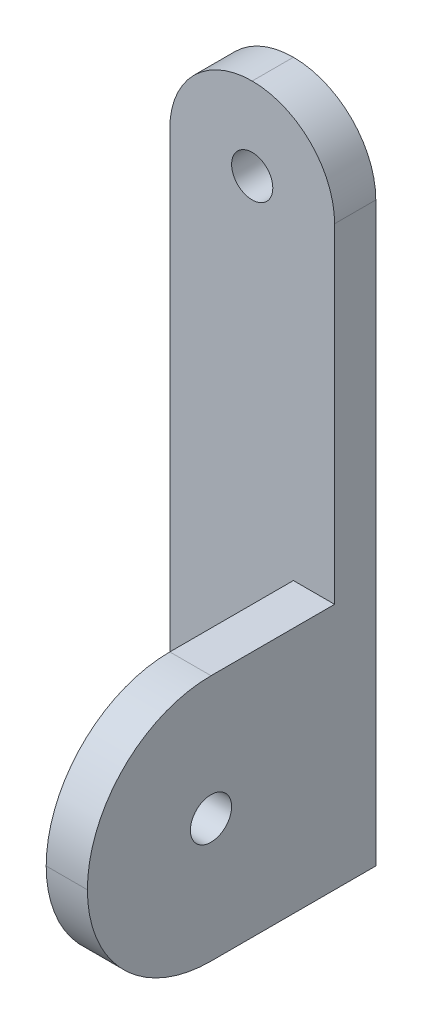
from build123d import *

# Parameters (mm, degrees)
ESQUISSE1_W             = 20
ESQUISSE1_H             = 80
BOSS_EXTRU_1_DEPTH      = 5
ESQUISSE2_R             = 2.5
ENL_V_MAT_EXTRU_1_DEPTH = 5
ESQUISSE3_W             = 5
ESQUISSE3_H             = 30
BOSS_EXTRU_2_DEPTH      = 30
ESQUISSE4_R             = 2.5
ENL_V_MAT_EXTRU_2_DEPTH = 30
CONG_1_R                = 15
CONG_2_R                = 10


with BuildPart() as part:
    # Esquisse1 → Boss.-Extru.1 (new body)
    with BuildSketch(Plane.XY):
        with Locations((-7.390726734, -27.034940778)):
            Rectangle(ESQUISSE1_W, ESQUISSE1_H)
    extrude(amount=BOSS_EXTRU_1_DEPTH)

    # Esquisse2 → Enlèv. mat.-Extru.1 (cut)
    with BuildSketch(Plane.XY.offset(5)):
        with Locations((-7.390726734, 2.965059222)):
            Circle(ESQUISSE2_R)
    extrude(amount=-ENL_V_MAT_EXTRU_1_DEPTH, mode=Mode.SUBTRACT)

    # Esquisse3 → Boss.-Extru.2 (add)
    with BuildSketch(Plane.XY.offset(5)):
        with Locations((0.109273266, -52.034940778)):
            Rectangle(ESQUISSE3_W, ESQUISSE3_H)
    extrude(amount=BOSS_EXTRU_2_DEPTH)

    # Esquisse4 → Enlèv. mat.-Extru.2 (cut)
    with BuildSketch(Plane(origin=(2.609273266, 0, 0), x_dir=(0, 0, -1), z_dir=(1, 0, 0))):
        with Locations(Location((-20, -52.034940778, 0), (0, 0, 90))):
            Circle(ESQUISSE4_R)
    extrude(amount=-ENL_V_MAT_EXTRU_2_DEPTH, mode=Mode.SUBTRACT)

    # Congé1
    cong_1_edges = [part.edges().sort_by_distance(p)[0] for p in [
        (0.109273266, -67.034940778, 35),
        (0.109273266, -37.034940778, 35),
    ]]
    fillet(cong_1_edges, radius=CONG_1_R - 0.0001)  # a hair under: the kernel refuses the full size

    # Congé2
    cong_2_edges = [part.edges().sort_by_distance(p)[0] for p in [
        (-17.390726734, -67.034940778, 2.5),
        (2.609273266, 12.965059222, 2.5),
        (-17.390726734, 12.965059222, 2.5),
    ]]
    fillet(cong_2_edges, radius=CONG_2_R - 0.0001)  # a hair under: the kernel refuses the full size


solid = part.part
